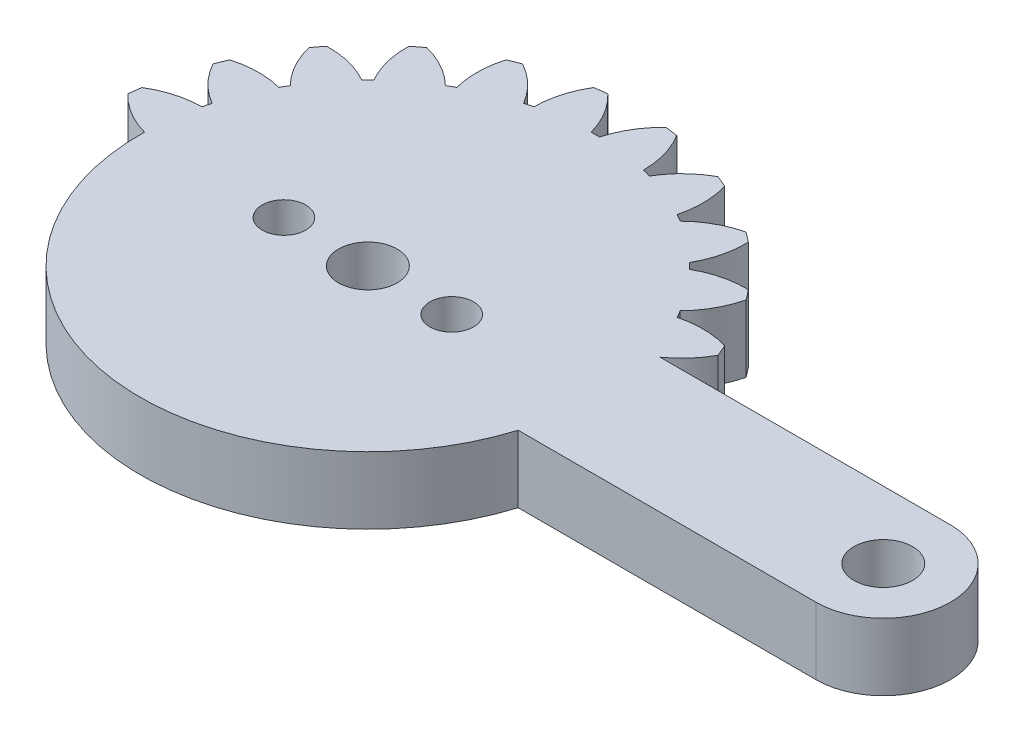
from build123d import *

# Parameters (mm, degrees)
IZIM2_R                     = 16.13
IZIM2_R_2                   = 1.75
IZIM2_R_3                   = 1.3
IZIM2_R_4                   = 1.29986265
Y_KSEKLIK_EKSTR_ZYON1_DEPTH = 4
KES_EKSTR_ZYON2_DEPTH       = 4
DAIRESEL_KAPLAMA2_COUNT     = 24
IZIM4_R                     = 1.75
Y_KSEKLIK_EKSTR_ZYON2_DEPTH = 4
KES_EKSTR_ZYON3_DEPTH       = 4


with BuildPart() as part:
    # Çizim2 → Yükseklik-Ekstrüzyon1 (new body)
    with BuildSketch(Plane(origin=(0, 0, 0), x_dir=(1, 0, 0), z_dir=(0, 1, 0))):
        Circle(IZIM2_R)
        Circle(IZIM2_R_2, mode=Mode.SUBTRACT)
        with Locations((5, 0)):
            Circle(IZIM2_R_3, mode=Mode.SUBTRACT)
        with Locations((-5, 0)):
            Circle(IZIM2_R_4, mode=Mode.SUBTRACT)
    extrude(amount=Y_KSEKLIK_EKSTR_ZYON1_DEPTH)

    # Çizim1 → Kes-Ekstrüzyon2 (cut)
    with BuildSketch(Plane(origin=(0, 0, 0), x_dir=(1, 0, 0), z_dir=(0, 1, 0))):
        with BuildLine():
            ThreePointArc((0.25, 13.562696082), (0.821724337, 14.900419859), (1.729803678, 16.036978495))
            ThreePointArc((1.729803678, 16.036978495), (0, 16.13), (-1.729803678, 16.036978495))
            ThreePointArc((-1.729803678, 16.036978495), (-0.821724337, 14.900419859), (-0.25, 13.562696082))
            ThreePointArc((-0.25, 13.562696082), (-0.125005308, 13.564424008), (0, 13.565))
            ThreePointArc((0, 13.565), (0.125005308, 13.564424008), (0.25, 13.562696082))
        make_face()
    kes_ekstr_zyon2 = extrude(amount=KES_EKSTR_ZYON2_DEPTH, mode=Mode.SUBTRACT)

    # Dairesel Kaplama2: Kes-Ekstrüzyon2 ×24 about axis
    dairesel_kaplama2_axis = Axis((0, 4, 0), (0, 1, 0))
    for i in range(1, DAIRESEL_KAPLAMA2_COUNT):
        add(kes_ekstr_zyon2.rotate(dairesel_kaplama2_axis, i * 360 / DAIRESEL_KAPLAMA2_COUNT), mode=Mode.SUBTRACT)

    # Çizim4 → Yükseklik-Ekstrüzyon2 (add)
    with BuildSketch(Plane(origin=(0, 0, 0), x_dir=(1, 0, 0), z_dir=(0, 1, 0))):
        with BuildLine():
            Line((11.382628211, 4), (22.858544508, 4))
            Line((22.858544508, 4), (30.722628211, 4))
            ThreePointArc((30.722628211, 4), (34.722628211, 0), (30.722628211, -4))
            Line((30.722628211, -4), (22.391671269, -4))
            Line((22.391671269, -4), (11.382628211, -4))
            ThreePointArc((11.382628211, -4), (12.065, 0), (11.382628211, 4))
        make_face()
        with Locations((30.722628211, 0)):
            Circle(IZIM4_R, mode=Mode.SUBTRACT)
    extrude(amount=Y_KSEKLIK_EKSTR_ZYON2_DEPTH)

    # Çizim5 → Kes-Ekstrüzyon3 (cut)
    with BuildSketch(Plane(origin=(0, 0, 0), x_dir=(1, 0, 0), z_dir=(0, 1, 0))):
        with BuildLine():
            Line((-13.565, 0), (-18.52935314, 0))
            Line((-18.52935314, 0), (-18.52935314, -18.21120255))
            Line((-18.52935314, -18.21120255), (15.661629934, -18.576881513))
            Line((15.661629934, -18.576881513), (15.661629934, -4))
            Line((15.661629934, -4), (12.961837254, -4))
            ThreePointArc((12.961837254, -4), (-2.022610028, -13.413361759), (-13.565, 0))
        make_face()
    extrude(amount=KES_EKSTR_ZYON3_DEPTH, mode=Mode.SUBTRACT)


solid = part.part
